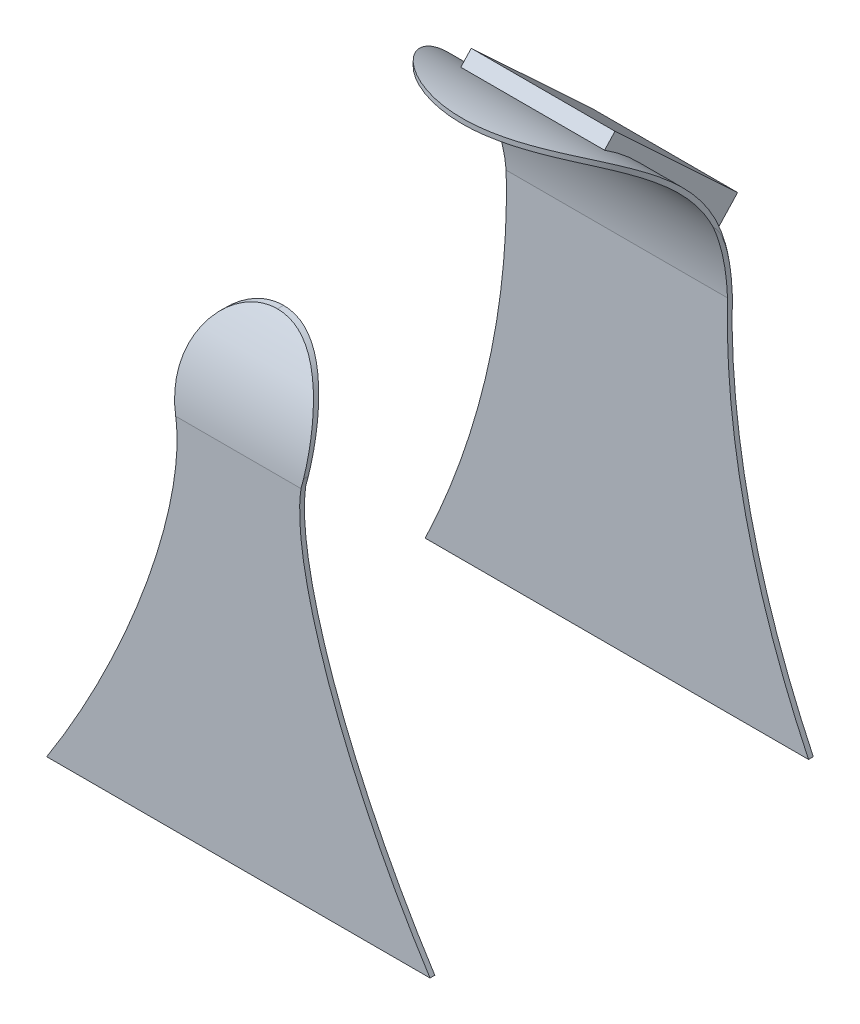
from build123d import *

# Parameters (mm, degrees)
EXTRUDE_THIN2_DEPTH = 160
CUT_EXTRUDE1_DEPTH  = 179
CUT_EXTRUDE2_DEPTH  = 80
CUT_EXTRUDE5_DEPTH  = 78
CUT_EXTRUDE6_DEPTH  = 78
CUT_EXTRUDE7_DEPTH  = 68
LOFT2_START         = 50
LOFT2_DEPTH         = 60


# Read off the part's stored shape, not the designer's step: Loft2
with BuildPart() as part:
    # Sketch1 → Extrude-Thin2 (new body)
    with BuildSketch(Plane(origin=(0, 0, 0), x_dir=(0, 0, -1), z_dir=(1, 0, 0))):
        with BuildLine():
            Line((-50.491613131, 0), (-50.491613131, 150))
            ThreePointArc((-50.491613131, 150), (29.508386869, 225.232993082), (109.508386869, 150))
            Line((109.508386869, 150), (109.508386869, 0))
            Line((109.508386869, 0), (107.508386869, 0))
            Line((107.508386869, 0), (107.508386869, 149.938194193))
            ThreePointArc((107.508386869, 149.938194193), (29.508386869, 223.232993082), (-48.491613131, 149.938194193))
            Line((-48.491613131, 149.938194193), (-48.491613131, 0))
            Line((-48.491613131, 0), (-50.491613131, 0))
        make_face()
    extrude(amount=EXTRUDE_THIN2_DEPTH)

    # Sketch3 → Cut-Extrude1 (cut)
    with BuildSketch(Plane.XY.offset(50.491613131)):
        with BuildLine():
            Line((20.340241487, 225.232993082), (-43.850637925, 225.232993082))
            Line((-43.850637925, 225.232993082), (-43.850637925, 0))
            Line((-43.850637925, 0), (0, 0))
            add(Edge.make_bspline(
                [(20.340241487, 225.232993082), (57.344395501, 119.979568003), (0, 0)],
                knots=[0, 0, 0, 1, 1, 1], degree=2, weights=[1, 0.915352517, 1]))
        make_face()
        with BuildLine():
            Line((139.659758513, 225.232993082), (237.834044673, 225.232993082))
            Line((237.834044673, 225.232993082), (237.834044673, 0))
            Line((237.834044673, 0), (160, 0))
            add(Edge.make_bspline(
                [(139.659758513, 225.232993082), (102.655604499, 119.979568003), (160, 0)],
                knots=[0, 0, 0, 1, 1, 1], degree=2, weights=[1, 0.915352517, 1]))
        make_face()
    extrude(amount=-CUT_EXTRUDE1_DEPTH, mode=Mode.SUBTRACT)

    # Sketch5 → Cut-Extrude2 (cut)
    with BuildSketch(Plane.XY.offset(50.491613131)):
        with BuildLine():
            ThreePointArc((51.047976489, 159.135187229), (80, 214.361921086), (108.952023511, 159.135187229))
            add(Edge.make_bspline(
                [(160, 0), (85.663913698, 115.920196198), (108.952023511, 159.135187229)],
                knots=[0, 0, 0, 1, 1, 1], degree=2, weights=[1, 0.679657952, 1]))
            add(Edge.make_bspline(
                [(0, 0), (-33.433205478, 98.2597118), (-92.169547545, 270.88497944), (251.875257592, 267.933052692), (193.262544876, 97.00256002), (160, 0)],
                knots=[0, 0, 0, 0, 0.363652734, 0.638874768, 1, 1, 1, 1], degree=3))
            add(Edge.make_bspline(
                [(0, 0), (74.336086302, 115.920196198), (51.047976489, 159.135187229)],
                knots=[0, 0, 0, 1, 1, 1], degree=2, weights=[1, 0.679657952, 1]))
        make_face()
    extrude(amount=-CUT_EXTRUDE2_DEPTH, mode=Mode.SUBTRACT)


with BuildPart() as cut_extrude2_piece_1:
    # of the separate pieces the step leaves, piece 1, a body of its own (cut_extrude2_pieces)
    add(part.part.solids().sort_by_distance((33.807007412, 149.938194193, -107.508386869))[0])

    # Sketch10 → Cut-Extrude5 (cut)
    with BuildSketch(Plane(origin=(0, 150, 0), x_dir=(1, 0, 0), z_dir=(0, 1, 0))):
        with BuildLine():
            Line((33.097360697, 107.508386869), (-15.33533231, 97.376304314))
            Line((-15.33533231, 97.376304314), (20.38462424, 5.982484451))
            Line((20.38462424, 5.982484451), (166.466929304, 13.126475761))
            Line((166.466929304, 13.126475761), (169.669408167, 102.442345591))
            Line((169.669408167, 102.442345591), (126.90264045, 107.508386869))
            ThreePointArc((126.90264045, 107.508386869), (80.000000574, 42.892709224), (33.097360697, 107.508386869))
        make_face()
    extrude(amount=CUT_EXTRUDE5_DEPTH, mode=Mode.SUBTRACT)

    # Loft2 outline → Loft2 (add)
    with BuildSketch(Plane.YZ.offset(LOFT2_START)):
        with BuildLine():
            Line((150, -109.508386869), (169.742407378, -127.918479586))
            Line((169.742407378, -127.918479586), (217.482292583, -76.723720472))
            Line((217.482292583, -76.723720472), (212.81121802, -72.367872974))
            ThreePointArc((212.81121802, -72.367872974), (185.877327129, -98.500600986), (150, -109.508386869))
        make_face()
    extrude(amount=LOFT2_DEPTH)


with BuildPart() as cut_extrude2_piece_2:
    # of the separate pieces the step leaves, piece 2, a body of its own (cut_extrude2_pieces)
    add(part.part.solids().sort_by_distance((0, 0, 48.491613131))[0])

    # Sketch12 → Cut-Extrude6 (cut)
    with BuildSketch(Plane.XY.offset(50.491613131)):
        with BuildLine():
            Line((44.797739009, 179.159660095), (17.793241852, 190.439711242))
            Line((17.793241852, 190.439711242), (68.570371636, 220.109961378))
            Line((68.570371636, 220.109961378), (118.640088357, 220.109961378))
            Line((118.640088357, 220.109961378), (141.94456078, 176.237110451))
            Line((141.94456078, 176.237110451), (115.202260991, 179.159660095))
            ThreePointArc((115.202260991, 179.159660095), (80, 193.740914023), (44.797739009, 179.159660095))
        make_face()
    extrude(amount=-CUT_EXTRUDE6_DEPTH, mode=Mode.SUBTRACT)

    # Sketch14 → Cut-Extrude7 (cut)
    with BuildSketch(Plane.XY.offset(50.491613131)):
        with BuildLine():
            add(Edge.make_bspline(
                [(106.151407013, 150), (116.392246667, 193.740914023), (80, 193.740914023)],
                knots=[0, 0, 0, 1, 1, 1], degree=2, weights=[1, 0.721533209, 1]))
            add(Edge.make_bspline(
                [(53.848592987, 150), (43.607753333, 193.740914023), (80, 193.740914023)],
                knots=[0, 0, 0, 1, 1, 1], degree=2, weights=[1, 0.721533209, 1]))
            Line((53.848592987, 150), (39.303107991, 151.029111088))
            Line((39.303107991, 151.029111088), (42.928623982, 202.272255846))
            Line((42.928623982, 202.272255846), (127.262633599, 196.30552016))
            Line((127.262633599, 196.30552016), (127.262633599, 153.380956131))
            Line((127.262633599, 153.380956131), (106.151407013, 150))
        make_face()
    extrude(amount=-CUT_EXTRUDE7_DEPTH, mode=Mode.SUBTRACT)


solid = Compound([cut_extrude2_piece_1.part, cut_extrude2_piece_2.part])
